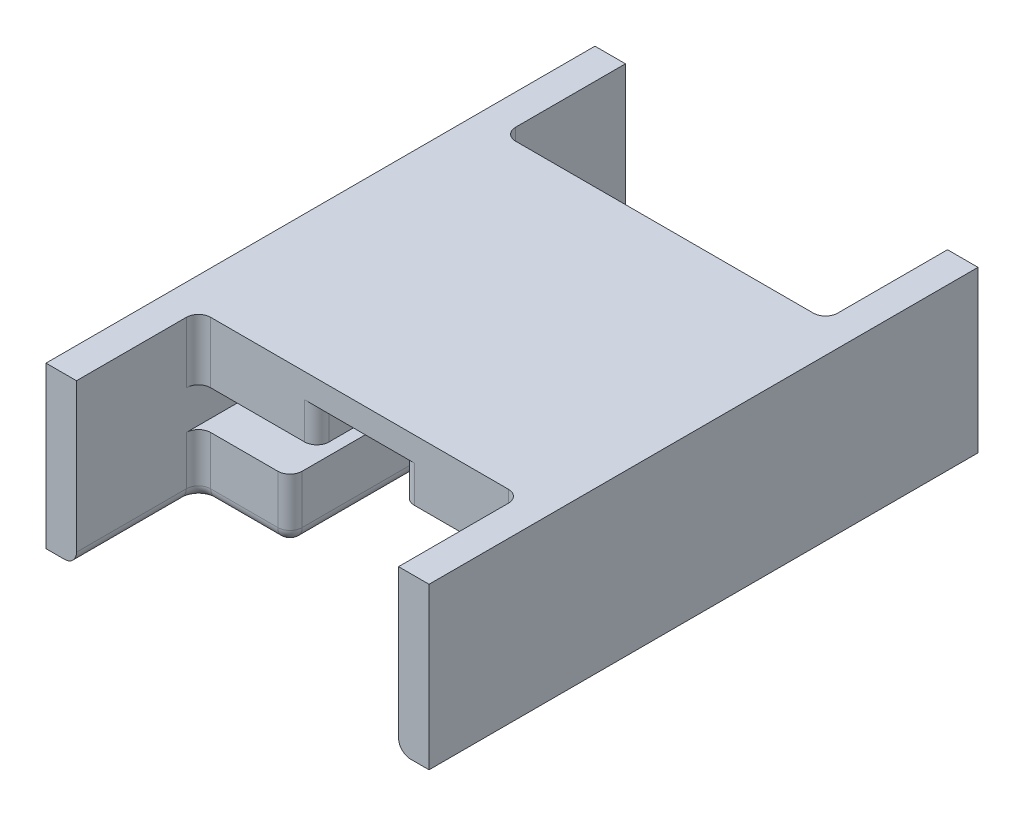
from build123d import *

# Parameters (mm, degrees)
BOSS_EXTRUDE1_DEPTH = 50
SKETCH2_W           = 5
SKETCH2_H           = 26.35
BOSS_EXTRUDE2_DEPTH = 20
SKETCH4_W           = 5
SKETCH4_H           = 26.35
BOSS_EXTRUDE3_DEPTH = 20
FILLET2_R           = 2


with BuildPart() as part:
    # Sketch1 → Boss-Extrude1 (new body)
    with BuildSketch(Plane.XY):
        Polygon((-35.507131788, 8.549060403), (-35.507131788, -17.800939597), (-15.507131788, -17.800939597), (-15.507131788, -7.800939597), (-30.507131788, -7.800939597), (-30.507131788, -1.450939597), (-11.107131788, -1.450939597), (-11.107131788, 4.549060403), (2.892868212, 4.549060403), (2.892868212, -1.450939597), (22.292868212, -1.450939597), (22.292868212, -7.800939597), (7.292868212, -7.800939597), (7.292868212, -17.800939597), (27.292868212, -17.800939597), (27.292868212, 8.549060403), align=None)
    extrude(amount=-BOSS_EXTRUDE1_DEPTH)

    # Sketch2 → Boss-Extrude2 (add)
    with BuildSketch(Plane.XY):
        with Locations((-33.007131788, -4.625939597)):
            Rectangle(SKETCH2_W, SKETCH2_H)
        with Locations((24.792868212, -4.625939597)):
            Rectangle(SKETCH2_W, SKETCH2_H)
    extrude(amount=BOSS_EXTRUDE2_DEPTH)

    # Sketch4 → Boss-Extrude3 (add)
    with BuildSketch(Plane(origin=(0, 0, -50), x_dir=(-1, 0, 0), z_dir=(0, 0, -1))):
        with Locations((-24.792868212, -4.625939597)):
            Rectangle(SKETCH4_W, SKETCH4_H)
        with Locations((33.007131788, -4.625939597)):
            Rectangle(SKETCH4_W, SKETCH4_H)
    extrude(amount=BOSS_EXTRUDE3_DEPTH)

    # Fillet2
    fillet2_edges = [part.edges().sort_by_distance(p)[0] for p in [
        (-30.507131788, -12.800939597, -50),
        (-30.507131788, 3.549060403, -50),
        (-30.507131788, -17.800939597, -60),
        (-30.507131788, 3.549060403, 0),
        (-30.507131788, -17.800939597, 10),
        (-23.007131788, -17.800939597, 0),
        (-15.507131788, -12.800939597, 0),
        (2.892868212, 1.549060403, 0),
        (-23.007131788, -17.800939597, -50),
        (-15.507131788, -12.800939597, -50),
        (2.892868212, 1.549060403, -50),
        (-15.507131788, -17.800939597, -25),
        (-30.507131788, -12.800939597, 0),
        (-11.107131788, 1.549060403, -50),
        (-11.107131788, 1.549060403, 0),
        (7.292868212, -12.800939597, -50),
        (7.292868212, -17.800939597, -25),
        (7.292868212, -12.800939597, 0),
        (22.292868212, -17.800939597, 10),
        (14.792868212, -17.800939597, 0),
        (22.292868212, -12.800939597, 0),
        (22.292868212, 3.549060403, 0),
        (22.292868212, 3.549060403, -50),
        (22.292868212, -12.800939597, -50),
        (22.292868212, -17.800939597, -60),
        (14.792868212, -17.800939597, -50),
    ]]
    fillet(fillet2_edges, radius=FILLET2_R)


solid = part.part
